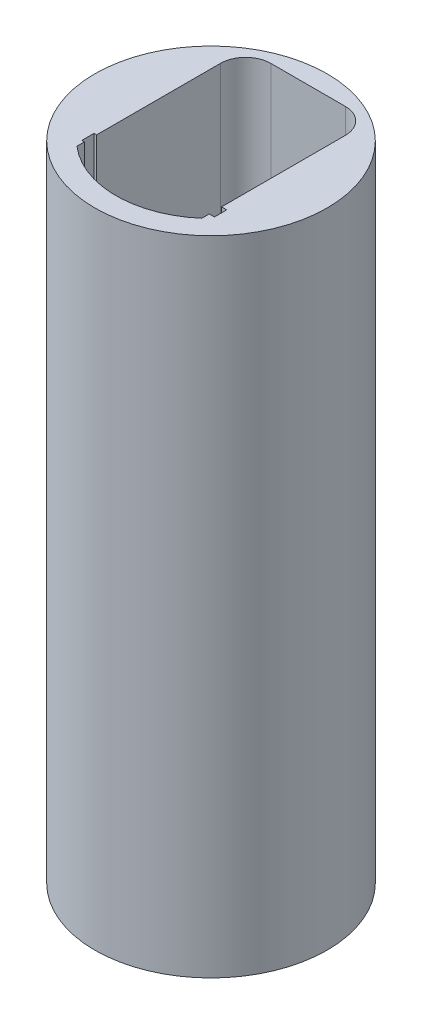
from build123d import *

# Parameters (mm, degrees)
SKETCH1_R           = 15.591175954
BOSS_EXTRUDE1_DEPTH = 71
BOSS_EXTRUDE2_START = 1.25
SKETCH2_R           = 15.591175954
SKETCH2_W           = 17.8
SKETCH2_H           = 1.65
BOSS_EXTRUDE2_DEPTH = 1.25
BOSS_EXTRUDE3_START = 4
SKETCH3_R           = 15.591175954
BOSS_EXTRUDE3_DEPTH = 4
CUT_EXTRUDE4_START  = -11.5
SKETCH16_R          = 0.75
CUT_EXTRUDE4_DEPTH  = 11.5
BOSS_EXTRUDE8_START = 10
SKETCH18_R          = 15.591175954
SKETCH18_R_2        = 13.095738675
BOSS_EXTRUDE8_DEPTH = 10
FILLET3_START       = -12.2500001
FILLET3_OUTLINE_R   = 13.095738675
FILLET3_OUTLINE_R_2 = 0.75
FILLET3_DEPTH       = 7.0000001
FILLET3_START_2     = -11
FILLET3_3_DEPTH     = 5.75


with BuildPart() as part:
    # Sketch1 → Boss-Extrude1 (new body)
    with BuildSketch(Plane(origin=(0, 0, 0), x_dir=(1, 0, 0), z_dir=(0, 1, 0))):
        with Locations(Location((0, 0, 0), (0, 0, 270))):
            Circle(SKETCH1_R)
        with BuildLine():
            Line((8.375, -6.964282891), (9.075, -6.964282891))
            Line((9.075, -6.964282891), (9.075, -8.614282891))
            Line((9.075, -8.614282891), (8.375, -8.614282891))
            Line((8.375, -8.614282891), (8.375, -9.610929808))
            ThreePointArc((8.375, -9.610929808), (0, -12.747964417), (-8.375, -9.610929808))
            Line((-8.375, -9.610929808), (-8.375, -8.614282891))
            Line((-8.375, -8.614282891), (-8.725, -8.614282891))
            Line((-8.725, -8.614282891), (-8.725, -6.964282891))
            Line((-8.725, -6.964282891), (-8.375, -6.964282891))
            Line((-8.375, -6.964282891), (-8.375, -6.204282891))
            Line((-8.375, -6.204282891), (-8.375, 9.645717109))
            ThreePointArc((-8.375, 9.645717109), (-7.386485387, 12.032202496), (-5, 13.020717109))
            Line((-5, 13.020717109), (5, 13.020717109))
            ThreePointArc((5, 13.020717109), (7.386485387, 12.032202496), (8.375, 9.645717109))
            Line((8.375, 9.645717109), (8.375, -6.204282891))
            Line((8.375, -6.204282891), (8.375, -6.964282891))
        make_face(mode=Mode.SUBTRACT)
    extrude(amount=BOSS_EXTRUDE1_DEPTH)

    # Sketch2 → Boss-Extrude2 (add)
    with BuildSketch(Plane.XZ.offset(BOSS_EXTRUDE2_START)):
        with Locations(Location((0, 0, 0), (0, 0, 270))):
            Circle(SKETCH2_R)
        with Locations((0.175, 7.789282891)):
            Rectangle(SKETCH2_W, SKETCH2_H, mode=Mode.SUBTRACT)
    extrude(amount=-BOSS_EXTRUDE2_DEPTH)

    # Sketch3 → Boss-Extrude3 (add)
    with BuildSketch(Plane.XZ.offset(1.25).offset(BOSS_EXTRUDE3_START)):
        with Locations(Location((0, 0, 0), (0, 0, 270))):
            Circle(SKETCH3_R)
    extrude(amount=-BOSS_EXTRUDE3_DEPTH)

    # Sketch16 → Cut-Extrude4 (cut)
    with BuildSketch(Plane(origin=(0, 0, 0), x_dir=(1, 0, 0), z_dir=(0, 1, 0)).offset(CUT_EXTRUDE4_START)):
        with BuildLine():
            Line((-3.75, -9.901070776), (-3, -9.901070776))
            Line((-3, -9.901070776), (-2.25, -9.901070776))
            ThreePointArc((-2.25, -9.901070776), (-3, -9.151070776), (-3.75, -9.901070776))
        make_face()
        with BuildLine():
            Line((-2.25, -9.901070776), (-3, -9.901070776))
            Line((-3, -9.901070776), (-3.75, -9.901070776))
            ThreePointArc((-3.75, -9.901070776), (-3, -10.651070776), (-2.25, -9.901070776))
        make_face()
        with BuildLine():
            ThreePointArc((6.75, -9.901070776), (6, -9.151070776), (5.25, -9.901070776))
            ThreePointArc((5.25, -9.901070776), (6, -10.651070776), (6.75, -9.901070776))
        make_face()
        with BuildLine():
            ThreePointArc((3.75, -9.901070776), (3, -9.151070776), (2.25, -9.901070776))
            Line((2.25, -9.901070776), (3, -9.901070776))
            Line((3, -9.901070776), (3.75, -9.901070776))
        make_face()
        with BuildLine():
            Line((3, -9.901070776), (2.25, -9.901070776))
            ThreePointArc((2.25, -9.901070776), (3, -10.651070776), (3.75, -9.901070776))
            Line((3.75, -9.901070776), (3, -9.901070776))
        make_face()
        with BuildLine():
            ThreePointArc((0.75, -9.901070776), (0, -9.151070776), (-0.75, -9.901070776))
            Line((-0.75, -9.901070776), (0, -9.901070776))
            Line((0, -9.901070776), (0.75, -9.901070776))
        make_face()
        with BuildLine():
            Line((0, -9.901070776), (-0.75, -9.901070776))
            ThreePointArc((-0.75, -9.901070776), (0, -10.651070776), (0.75, -9.901070776))
            Line((0.75, -9.901070776), (0, -9.901070776))
        make_face()
        with Locations(Location((-6, -9.901070776, 0), (0, 0, 270))):
            Circle(SKETCH16_R)
        with BuildLine():
            ThreePointArc((5.289192257, -11.598924176), (4.550417773, -10.824582592), (3.789595018, -11.577272013))
            ThreePointArc((3.789595018, -11.577272013), (3.846450326, -11.860961254), (4.006459728, -12.102019552))
            ThreePointArc((4.006459728, -12.102019552), (4.654628095, -11.867815051), (5.289192257, -11.598924176))
        make_face()
        with BuildLine():
            ThreePointArc((2.290136401, -11.577272013), (1.540136401, -10.827272013), (0.790136401, -11.577272013))
            Line((0.790136401, -11.577272013), (1.540136401, -11.577272013))
            Line((1.540136401, -11.577272013), (2.290136401, -11.577272013))
        make_face()
        with BuildLine():
            Line((1.540136401, -11.577272013), (0.790136401, -11.577272013))
            ThreePointArc((0.790136401, -11.577272013), (1.540136401, -12.327272013), (2.290136401, -11.577272013))
            Line((2.290136401, -11.577272013), (1.540136401, -11.577272013))
        make_face()
        with BuildLine():
            ThreePointArc((-0.707561207, -11.577133163), (-2.207561203, -11.577063737), (-0.707561219, -11.577272013))
            ThreePointArc((-0.707561219, -11.577272013), (-0.70756121, -11.577202588), (-0.707561207, -11.577133163))
        make_face()
        with BuildLine():
            ThreePointArc((-5.205190023, -11.636863564), (-4.580517042, -11.896615502), (-3.942943702, -12.122862358))
            ThreePointArc((-3.942943702, -12.122862358), (-4.188076003, -10.877359358), (-5.205190023, -11.636863564))
        make_face()
    extrude(amount=CUT_EXTRUDE4_DEPTH, mode=Mode.SUBTRACT)

    # Sketch18 → Boss-Extrude8 (add)
    with BuildSketch(Plane.XZ.offset(5.25).offset(BOSS_EXTRUDE8_START)):
        with Locations(Location((0, 0, 0), (0, 0, 270))):
            Circle(SKETCH18_R)
        with Locations(Location((0, 0, 0), (0, 0, 270))):
            Circle(SKETCH18_R_2, mode=Mode.SUBTRACT)
    extrude(amount=-BOSS_EXTRUDE8_DEPTH)

    # Fillet3: read off the stored shape, not the designer's step
    # Fillet3 outline → Fillet3 (add)
    with BuildSketch(Plane(origin=(0, 0, 0), x_dir=(1, 0, 0), z_dir=(0, 1, 0)).offset(FILLET3_START)):
        Circle(FILLET3_OUTLINE_R)
        with Locations((-6, -9.901070776)):
            Circle(FILLET3_OUTLINE_R_2, mode=Mode.SUBTRACT)
        with Locations((-1.457561207, -11.577133163)):
            Circle(FILLET3_OUTLINE_R_2, mode=Mode.SUBTRACT)
        with Locations((-3, -9.901070776)):
            Circle(FILLET3_OUTLINE_R_2, mode=Mode.SUBTRACT)
        with Locations((1.540136401, -11.577272013)):
            Circle(FILLET3_OUTLINE_R_2, mode=Mode.SUBTRACT)
        with Locations((0, -9.901070776)):
            Circle(FILLET3_OUTLINE_R_2, mode=Mode.SUBTRACT)
        with Locations((3, -9.901070776)):
            Circle(FILLET3_OUTLINE_R_2, mode=Mode.SUBTRACT)
        with Locations((6, -9.901070776)):
            Circle(FILLET3_OUTLINE_R_2, mode=Mode.SUBTRACT)
    extrude(amount=FILLET3_DEPTH)

    # Fillet3 2 outline → Fillet3 2 (revolve, cut)
    with BuildSketch(Plane.XY):
        with BuildLine():
            Line((6.095738675, -5.25), (0, -5.25))
            Line((0, -5.25), (0, -12.25))
            Line((0, -12.25), (13.095738675, -12.25))
            ThreePointArc((13.095738675, -12.25), (11.045486143, -7.300252532), (6.095738675, -5.25))
        make_face()
    revolve(axis=Axis((0, 0, 0), (0, 1, 0)), mode=Mode.SUBTRACT)

    # Fillet3 3 outline → Fillet3 3 (cut)
    with BuildSketch(Plane(origin=(0, 0, 0), x_dir=(1, 0, 0), z_dir=(0, 1, 0)).offset(FILLET3_START_2)):
        with BuildLine():
            ThreePointArc((4.006459728, -12.102019552), (4.654628094, -11.867815051), (5.289192257, -11.598924176))
            ThreePointArc((5.289192257, -11.598924176), (4.265744538, -10.876286186), (4.006459728, -12.102019552))
        make_face()
        with BuildLine():
            ThreePointArc((-5.205190023, -11.636863564), (-4.580517042, -11.896615502), (-3.942943702, -12.122862358))
            ThreePointArc((-3.942943702, -12.122862358), (-4.188076003, -10.877359358), (-5.205190023, -11.636863564))
        make_face()
    extrude(amount=FILLET3_3_DEPTH, mode=Mode.SUBTRACT)


solid = part.part
